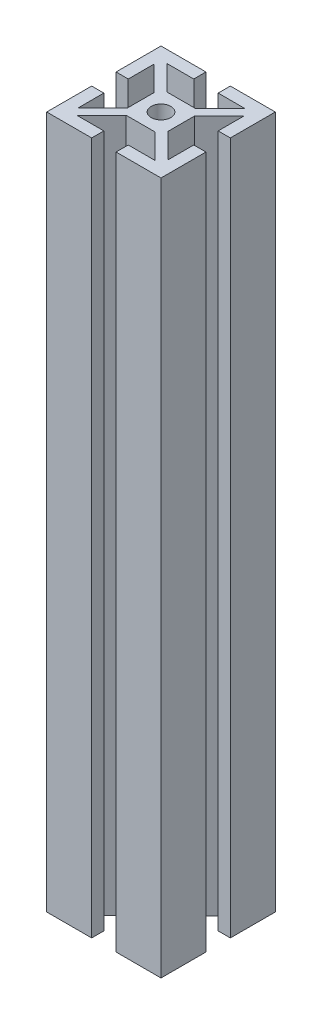
from build123d import *

# Parameters (mm, degrees)
EXTRUDE1_DEPTH = 230.9876


# Read off the part's stored shape, not the designer's step: 1515<1>
with BuildPart() as part:
    # Sketch1<2> → Extrude1 (new body)
    with BuildSketch(Plane(origin=(0, 0, 0), x_dir=(1, 0, 0), z_dir=(0, 1, 0))):
        Polygon((-6.7564, 4.364749804), (-6.7564, -4.364749804), (-14.986, -12.594349804), (-14.986, -4.064), (-19.05, -4.064), (-19.05, -19.05), (-4.064, -19.05), (-4.064, -14.986), (-13.067127258, -14.986), (-4.837527258, -6.7564), (4.837527258, -6.7564), (13.067127258, -14.986), (4.064, -14.986), (4.064, -19.05), (19.05, -19.05), (19.05, -4.064), (14.986, -4.064), (14.986, -12.594349804), (6.7564, -4.364749804), (6.7564, 4.364749804), (14.986, 12.594349804), (14.986, 4.064), (19.05, 4.064), (19.05, 19.05), (4.064, 19.05), (4.064, 14.986), (13.067127258, 14.986), (4.837527258, 6.7564), (-4.837527258, 6.7564), (-13.067127258, 14.986), (-4.064, 14.986), (-4.064, 19.05), (-19.05, 19.05), (-19.05, 4.064), (-14.986, 4.064), (-14.986, 12.594349804), align=None)
    extrude(amount=EXTRUDE1_DEPTH)

    # Sketch2 → 5/16-18 Tapped Hole1 (revolve, cut)
    with BuildSketch(Plane(origin=(0, 230.9876, 0), x_dir=(0, 0, 1), z_dir=(1, 0, 0))):
        Polygon((0, 0), (0, 33.711148974), (3.2639, 31.75), (3.2639, 0), align=None)
    f_5_16_18_tapped_hole1 = revolve(axis=Axis((0, 237.3376, 0), (0, -1, 0)), mode=Mode.SUBTRACT)

    # Mirror1: 5/16-18 Tapped Hole1 across plane
    add(f_5_16_18_tapped_hole1.mirror(Plane.ZX.offset(115.4938)), mode=Mode.SUBTRACT)


solid = part.part
